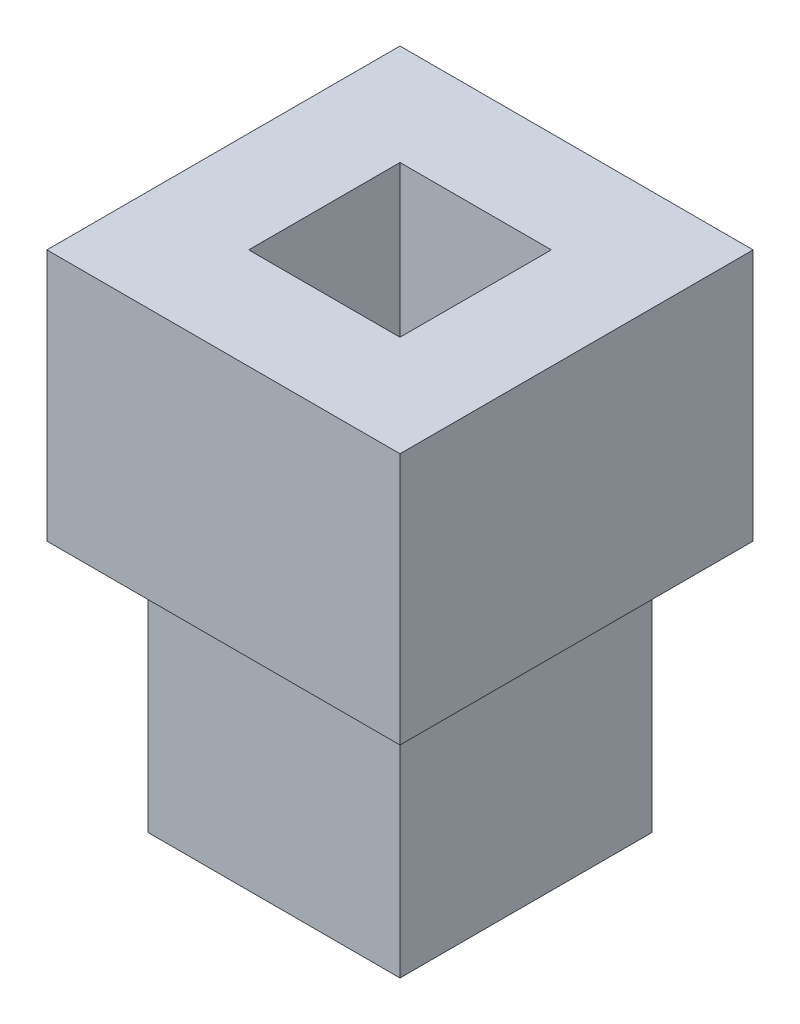
from build123d import *

# Parameters (mm, degrees)
SKETCH1_W           = 35
SKETCH1_H           = 35
SKETCH1_W_2         = 15
SKETCH1_H_2         = 15
BOSS_EXTRUDE1_DEPTH = 25
SKETCH1_3_W         = 25
SKETCH1_3_H         = 25
SKETCH1_3_W_2       = 15
SKETCH1_3_H_2       = 15
BOSS_EXTRUDE2_DEPTH = 25


with BuildPart() as part:
    # Sketch1 → Boss-Extrude1 (new body)
    with BuildSketch(Plane(origin=(0, 0, 0), x_dir=(1, 0, 0), z_dir=(0, 1, 0))):
        Rectangle(SKETCH1_W, SKETCH1_H)
        Rectangle(SKETCH1_W_2, SKETCH1_H_2, mode=Mode.SUBTRACT)
    extrude(amount=BOSS_EXTRUDE1_DEPTH)

    # Sketch1<3> → Boss-Extrude2 (add)
    with BuildSketch(Plane(origin=(0, 0, 0), x_dir=(1, 0, 0), z_dir=(0, 1, 0))):
        Rectangle(SKETCH1_3_W, SKETCH1_3_H)
        Rectangle(SKETCH1_3_W_2, SKETCH1_3_H_2, mode=Mode.SUBTRACT)
    extrude(amount=-BOSS_EXTRUDE2_DEPTH)


solid = part.part
